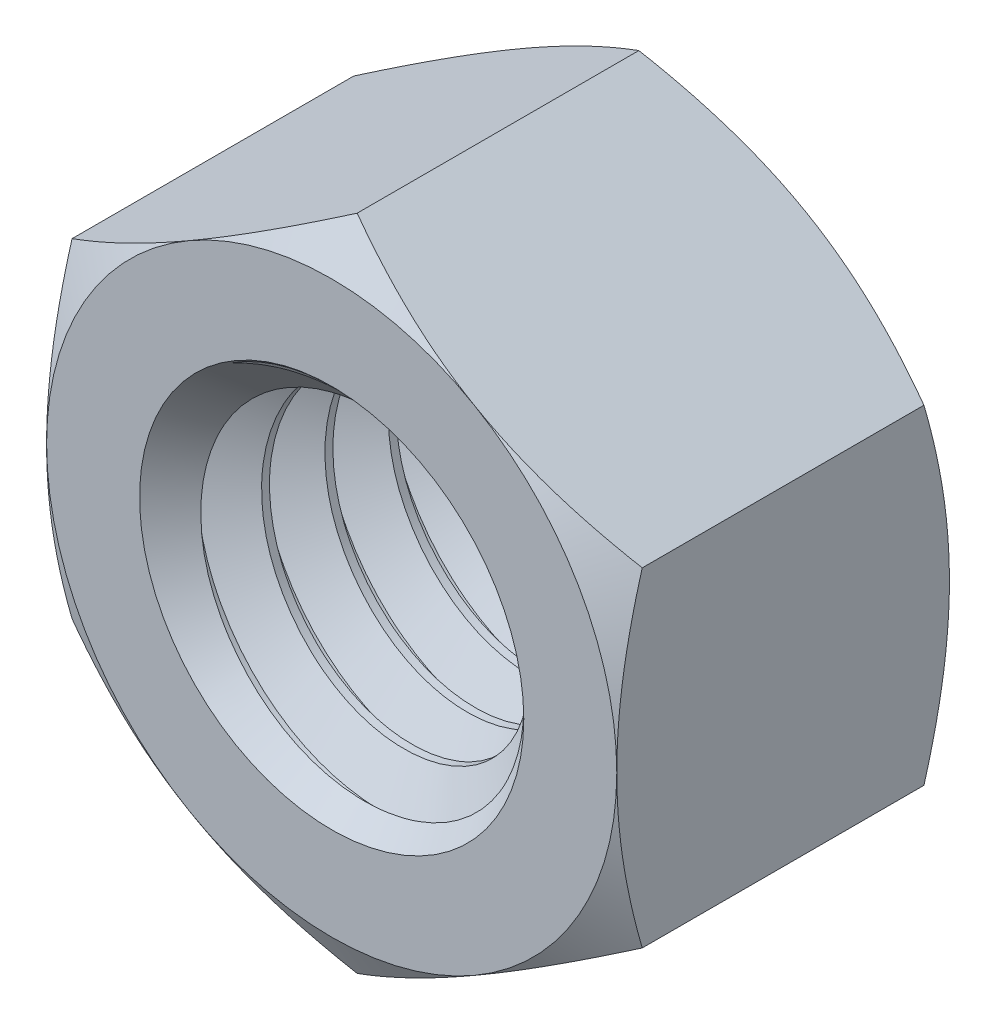
from build123d import *

# Parameters (mm, degrees)
EXTRUDE1_DEPTH     = 8.334375
SKETCH2_OUTSIDE_W  = 71.99
SKETCH2_OUTSIDE_H  = 74.2
SKETCH2_OUTSIDE_R  = 7.14375
CUT_EXTRUDE6_DEPTH = 14.730957339
CUT_EXTRUDE6_DRAFT = -60
SKETCH4_OUTSIDE_W  = 42.958
SKETCH4_OUTSIDE_H  = 45.168
SKETCH4_OUTSIDE_R  = 7.14375
CUT_EXTRUDE3_DEPTH = 6.35
CUT_EXTRUDE3_DRAFT = -60
SKETCH5_R          = 4.7625
CUT_EXTRUDE4_DEPTH = 14.730957339
SWEEP1_PITCH       = 1.5875
SKETCH8_R          = 5.2705
CUT_EXTRUDE5_DEPTH = 15.615949895
CUT_EXTRUDE8_DEPTH = 14.730957452


with BuildPart() as part:
    # Sketch1 → Extrude1 (new body)
    with BuildSketch(Plane.XY):
        Polygon((0, 8.248891971), (-7.14375, 4.124445986), (-7.14375, -4.124445986), (0, -8.248891971), (7.14375, -4.124445986), (7.14375, 4.124445986), align=None)
    extrude(amount=-EXTRUDE1_DEPTH)


with BuildPart() as cut_extrude6_tool:
    # Sketch2 outside → Cut-Extrude6 (with draft: the straight prism first)
    with BuildSketch(Plane.XY):
        Rectangle(SKETCH2_OUTSIDE_W, SKETCH2_OUTSIDE_H)
        Circle(SKETCH2_OUTSIDE_R, mode=Mode.SUBTRACT)
    extrude(amount=-CUT_EXTRUDE6_DEPTH)
    # Cut-Extrude6: the draft: its side faces are tilted about the plane it starts from
    cut_extrude6_sides = [cut_extrude6_tool.faces().sort_by_distance(p)[0] for p in [
        (0, -37.1, -7.36547867),
        (35.995, 0, -7.36547867),
        (0, 37.1, -7.36547867),
        (-35.995, 0, -7.36547867),
        (-7.14375, 0, -7.36547867),
    ]]
    draft(cut_extrude6_sides, Plane.XY, CUT_EXTRUDE6_DRAFT)


with BuildPart() as part_1:
    add(part.part)

    # Cut-Extrude6: cut by cut_extrude6_tool
    add(cut_extrude6_tool.part, mode=Mode.SUBTRACT)


with BuildPart() as cut_extrude3_tool:
    # Sketch4 outside → Cut-Extrude3 (with draft: the straight prism first)
    with BuildSketch(Plane(origin=(0, 0, -8.334375), x_dir=(-1, 0, 0), z_dir=(0, 0, -1))):
        Rectangle(SKETCH4_OUTSIDE_W, SKETCH4_OUTSIDE_H)
        Circle(SKETCH4_OUTSIDE_R, mode=Mode.SUBTRACT)
    extrude(amount=-CUT_EXTRUDE3_DEPTH)
    # Cut-Extrude3: the draft: its side faces are tilted about the plane it starts from
    cut_extrude3_sides = [cut_extrude3_tool.faces().sort_by_distance(p)[0] for p in [
        (0, -22.584, -5.159375),
        (-21.479, 0, -5.159375),
        (0, 22.584, -5.159375),
        (21.479, 0, -5.159375),
        (7.14375, 0, -5.159375),
    ]]
    draft(cut_extrude3_sides, Plane(origin=(0, 0, -8.334375), x_dir=(-1, 0, 0), z_dir=(0, 0, -1)), CUT_EXTRUDE3_DRAFT)


with BuildPart() as part_2:
    add(part_1.part)

    # Cut-Extrude3: cut by cut_extrude3_tool
    add(cut_extrude3_tool.part, mode=Mode.SUBTRACT)

    # Sketch5 → Cut-Extrude4 (cut, through all)
    with BuildSketch(Plane.XY):
        Circle(SKETCH5_R)
    extrude(amount=-CUT_EXTRUDE4_DEPTH, mode=Mode.SUBTRACT)

    # Sweep1: arcs per turn and ends read off the stored shape
    # Sweep1: the profile of Sketch7 profile screwed along a right-hand helix through 10 turns, 6 arcs to a turn; built about Z, then put on its axis
    sweep1_z = Axis((0, 0, 0), (0, 0, 1))
    sweep1_corners = [(4.7628, 0, -1.389235705), (4.7628, 0, 0.000173205), (3.731388504, 0, -0.5953125), (3.731388504, 0, -0.79375)]
    with BuildLine(mode=Mode.PRIVATE) as sweep1_profile:
        Line(sweep1_corners[0], sweep1_corners[1])
        Line(sweep1_corners[1], sweep1_corners[2])
        Line(sweep1_corners[2], sweep1_corners[3])
        Line(sweep1_corners[3], sweep1_corners[0])
    sweep1_cap = Face(sweep1_profile.wire())
    sweep1_turn_angles = [0, 30, 60, 90, 120, 150, 180, 210, 240, 270, 300, 330, 360]
    sweep1_turn_weights = [1, 0.8660254037844387, 1, 0.8660254037844387, 1, 0.8660254037844387, 1, 0.8660254037844387, 1, 0.8660254037844387, 1, 0.8660254037844387, 1]
    sweep1_turn_rails = [Edge.make_bspline([Vector(p[0], p[1], 0).rotate(sweep1_z, sweep1_turn_angles[k]) / sweep1_turn_weights[k] + Vector(0, 0, p[2] + SWEEP1_PITCH * sweep1_turn_angles[k] / 360) for k in range(13)], [0, 0, 0, 1, 1, 2, 2, 3, 3, 4, 4, 5, 5, 6, 6, 6], 2, sweep1_turn_weights) for p in sweep1_corners]
    sweep1_turn_sides = [Face.make_surface_from_curves(sweep1_turn_rails[p[0]], sweep1_turn_rails[p[1]]) for p in [(0, 1), (1, 2), (2, 3), (3, 0)]]
    sweep1 = Plane(origin=(0, 0, 0), x_dir=(0, 1, 0), z_dir=(0, 0, -1)) * Solid(Shell([*[p.moved(Location((0, 0, SWEEP1_PITCH * i))) for i in range(10) for p in sweep1_turn_sides], sweep1_cap, sweep1_cap.rotate(sweep1_z, 3600).moved(Location((0, 0, SWEEP1_PITCH * 3600 / 360)))]))
    add(sweep1)

    # Sketch8 → Cut-Extrude5 (cut, through all)
    with BuildSketch(Plane(origin=(0, 0, -8.334375), x_dir=(-1, 0, 0), z_dir=(0, 0, -1))):
        Circle(SKETCH8_R)
    extrude(amount=CUT_EXTRUDE5_DEPTH, mode=Mode.SUBTRACT)

    # Sketch10 → Cut-Extrude8 (cut, through all)
    with BuildSketch(Plane.XY):
        with BuildLine():
            ThreePointArc((3.571875, -6.186668978), (6.186668978, -3.571875), (7.14375, 0))
            ThreePointArc((7.14375, 0), (6.186668978, 3.571875), (3.571875, 6.186668978))
            ThreePointArc((3.571875, 6.186668978), (0, 7.14375), (-3.571875, 6.186668978))
            ThreePointArc((-3.571875, 6.186668978), (-6.186668978, 3.571875), (-7.14375, 0))
            ThreePointArc((-7.14375, 0), (-6.186668978, -3.571875), (-3.571875, -6.186668978))
            ThreePointArc((-3.571875, -6.186668978), (0, -7.14375), (3.571875, -6.186668978))
        make_face()
    extrude(amount=CUT_EXTRUDE8_DEPTH, mode=Mode.SUBTRACT)

    # Cut-Extrude7 cone 1 section (through the dimple's axis) → Cut-Extrude7 (revolve, cut)
    with BuildSketch(Plane(origin=(0, 0, -8.334375), x_dir=(0, 1, 0), z_dir=(1, 0, 0))):
        Polygon((0, 0), (4.8133, 0), (0, 4.8133), align=None)
    revolve(axis=Axis((0, 0, -8.334375), (0, 0, 1)), mode=Mode.SUBTRACT)

    # Cut-Extrude9 cone 1 section (through the dimple's axis) → Cut-Extrude9 (revolve, cut)
    with BuildSketch(Plane(origin=(0, 0, 0), x_dir=(0, -1, 0), z_dir=(1, 0, 0))):
        Polygon((0, 0), (4.8133, 0), (0, 4.8133), align=None)
    revolve(axis=Axis((0, 0, 0), (0, 0, -1)), mode=Mode.SUBTRACT)


solid = part_2.part
